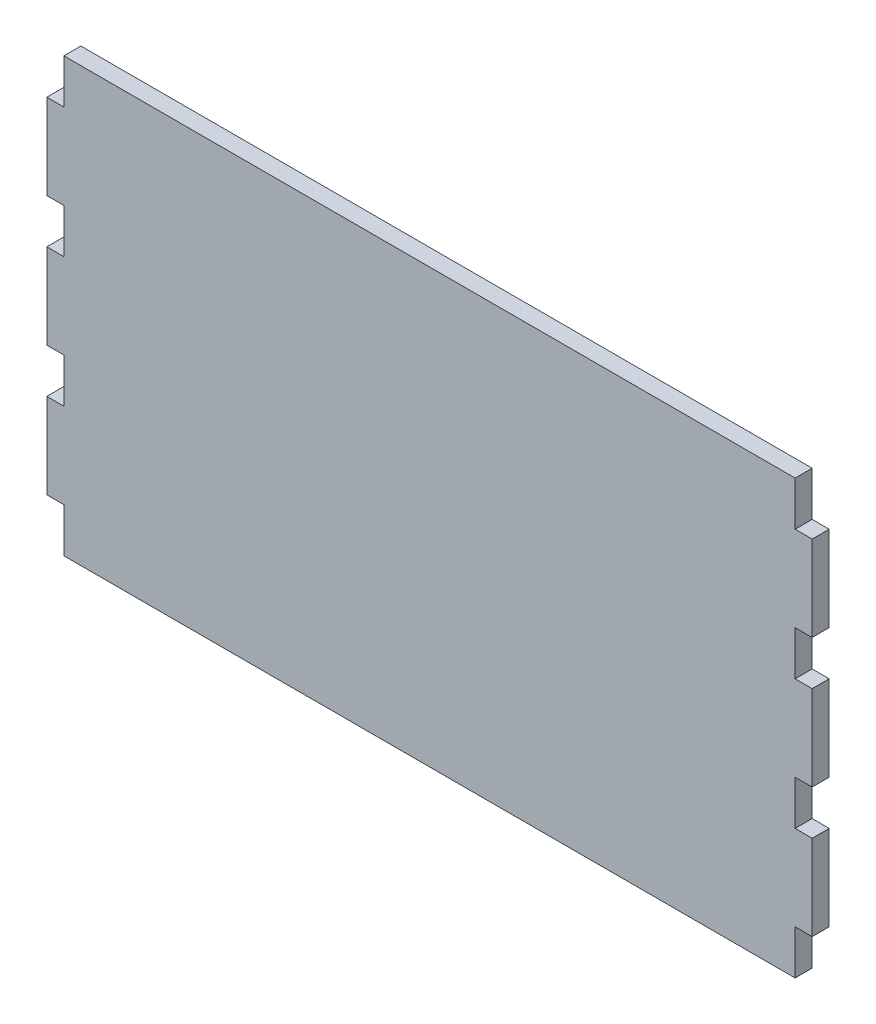
from build123d import *

# Parameters (mm, degrees)
SKETCH1_W               = 134.7
SKETCH1_H               = 76.2
BOSS_EXTRUDE1_DEPTH     = 3
SKETCH2_W               = 3
SKETCH2_H               = 7.8
CUT_EXTRUDE1_DEPTH      = 78.437926754
LPATTERN1_COUNT         = 4
LPATTERN1_PITCH         = 22.8
MIRROR4_COPY_1_SKETCH_W = 3
MIRROR4_COPY_1_SKETCH_H = 7.8
MIRROR4_COPY_1_DEPTH    = 78.437926754
MIRROR4_COPY_2_SKETCH_W = 3
MIRROR4_COPY_2_SKETCH_H = 7.8
MIRROR4_COPY_2_DEPTH    = 78.437926754
MIRROR4_COPY_3_SKETCH_W = 3
MIRROR4_COPY_3_SKETCH_H = 7.8
MIRROR4_COPY_3_DEPTH    = 78.437926754
MIRROR4_COPY_4_SKETCH_W = 3
MIRROR4_COPY_4_SKETCH_H = 7.8
MIRROR4_COPY_4_DEPTH    = 78.437926754


with BuildPart() as part:
    # Sketch1 → Boss-Extrude1 (new body)
    with BuildSketch(Plane.XY):
        Rectangle(SKETCH1_W, SKETCH1_H)
    extrude(amount=BOSS_EXTRUDE1_DEPTH)

    # Sketch2 → Cut-Extrude1 (cut, through all)
    with BuildSketch(Plane.XY.offset(3)):
        with Locations((-65.85, 34.2)):
            Rectangle(SKETCH2_W, SKETCH2_H)
    cut_extrude1 = extrude(amount=-CUT_EXTRUDE1_DEPTH, mode=Mode.SUBTRACT)

    # LPattern1: Cut-Extrude1 ×4
    with Locations(*[(0, -i * LPATTERN1_PITCH, 0) for i in range(1, LPATTERN1_COUNT)]):
        add(cut_extrude1, mode=Mode.SUBTRACT)

    # Mirror4 copy 1 sketch → Mirror4 copy 1 (cut, through all)
    with BuildSketch(Plane(origin=(0, -22.8, 3), x_dir=(-1, 0, 0), z_dir=(0, 0, 1))):
        with Locations((-65.85, -34.2)):
            Rectangle(MIRROR4_COPY_1_SKETCH_W, MIRROR4_COPY_1_SKETCH_H)
    extrude(amount=-MIRROR4_COPY_1_DEPTH, mode=Mode.SUBTRACT)

    # Mirror4 copy 2 sketch → Mirror4 copy 2 (cut, through all)
    with BuildSketch(Plane(origin=(0, -45.6, 3), x_dir=(-1, 0, 0), z_dir=(0, 0, 1))):
        with Locations((-65.85, -34.2)):
            Rectangle(MIRROR4_COPY_2_SKETCH_W, MIRROR4_COPY_2_SKETCH_H)
    extrude(amount=-MIRROR4_COPY_2_DEPTH, mode=Mode.SUBTRACT)

    # Mirror4 copy 3 sketch → Mirror4 copy 3 (cut, through all)
    with BuildSketch(Plane(origin=(0, -68.4, 3), x_dir=(-1, 0, 0), z_dir=(0, 0, 1))):
        with Locations((-65.85, -34.2)):
            Rectangle(MIRROR4_COPY_3_SKETCH_W, MIRROR4_COPY_3_SKETCH_H)
    extrude(amount=-MIRROR4_COPY_3_DEPTH, mode=Mode.SUBTRACT)

    # Mirror4 copy 4 sketch → Mirror4 copy 4 (cut, through all)
    with BuildSketch(Plane(origin=(0, 0, 3), x_dir=(-1, 0, 0), z_dir=(0, 0, 1))):
        with Locations((-65.85, -34.2)):
            Rectangle(MIRROR4_COPY_4_SKETCH_W, MIRROR4_COPY_4_SKETCH_H)
    extrude(amount=-MIRROR4_COPY_4_DEPTH, mode=Mode.SUBTRACT)


solid = part.part
